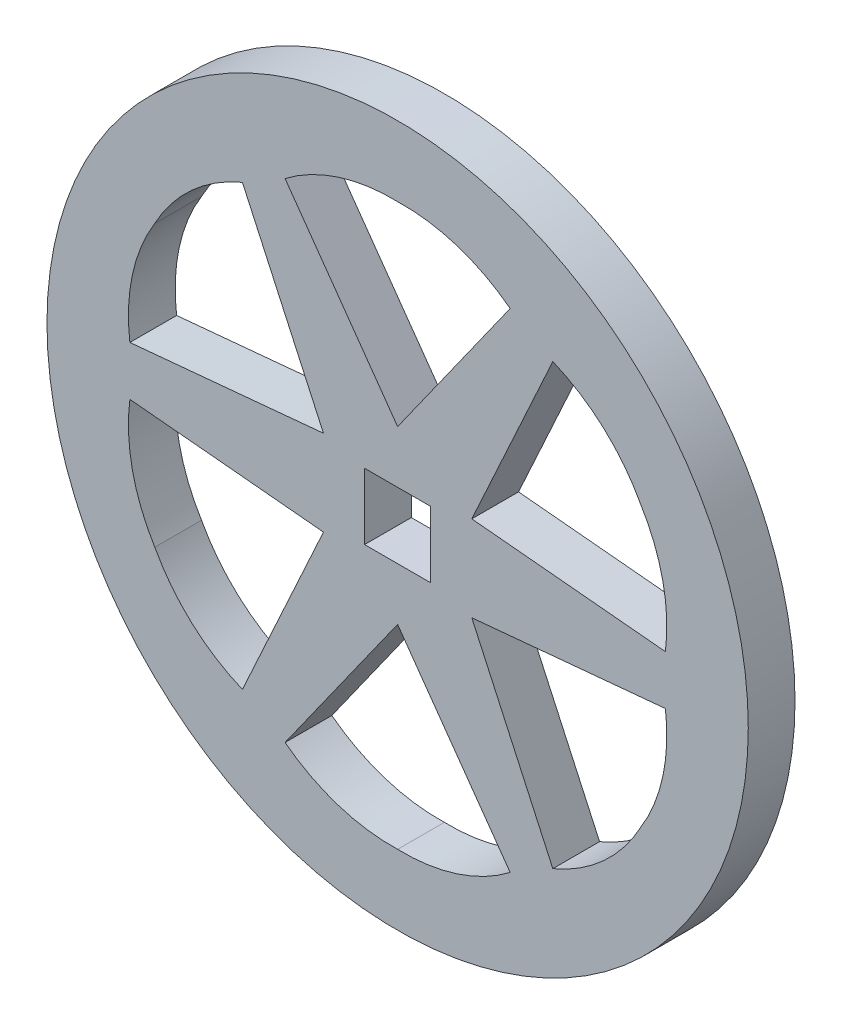
from build123d import *

# Parameters (mm, degrees)
SKETCH1_R           = 37.5
SKETCH1_W           = 7.071067812
SKETCH1_H           = 7.071067812
BOSS_EXTRUDE1_DEPTH = 2.5
CUT_EXTRUDE1_DEPTH  = 4
CIRPATTERN1_COUNT   = 6


with BuildPart() as part:
    # Sketch1 → Boss-Extrude1 (new, symmetric)
    with BuildSketch(Plane.XY):
        Circle(SKETCH1_R)
        Rectangle(SKETCH1_W, SKETCH1_H, mode=Mode.SUBTRACT)
    extrude(amount=BOSS_EXTRUDE1_DEPTH, both=True)

    # Sketch2 → Cut-Extrude1 (cut, symmetric)
    with BuildSketch(Plane.XY):
        with BuildLine():
            Line((0, 9.158641407), (-12.037071564, 26.115211784))
            ThreePointArc((-12.037071564, 26.115211784), (-6.351662121, 29.087034336), (0, 29.988143709))
            ThreePointArc((0, 29.988143709), (6.351662121, 29.087034336), (12.037071564, 26.115211784))
            Line((12.037071564, 26.115211784), (0, 9.158641407))
        make_face()
    cut_extrude1 = extrude(amount=CUT_EXTRUDE1_DEPTH, both=True, mode=Mode.SUBTRACT)

    # CirPattern1: Cut-Extrude1 ×6 about axis
    cirpattern1_axis = Axis((0, 0, 2.5), (0, 0, -1))
    for i in range(1, CIRPATTERN1_COUNT):
        add(cut_extrude1.rotate(cirpattern1_axis, i * 360 / CIRPATTERN1_COUNT), mode=Mode.SUBTRACT)


solid = part.part
